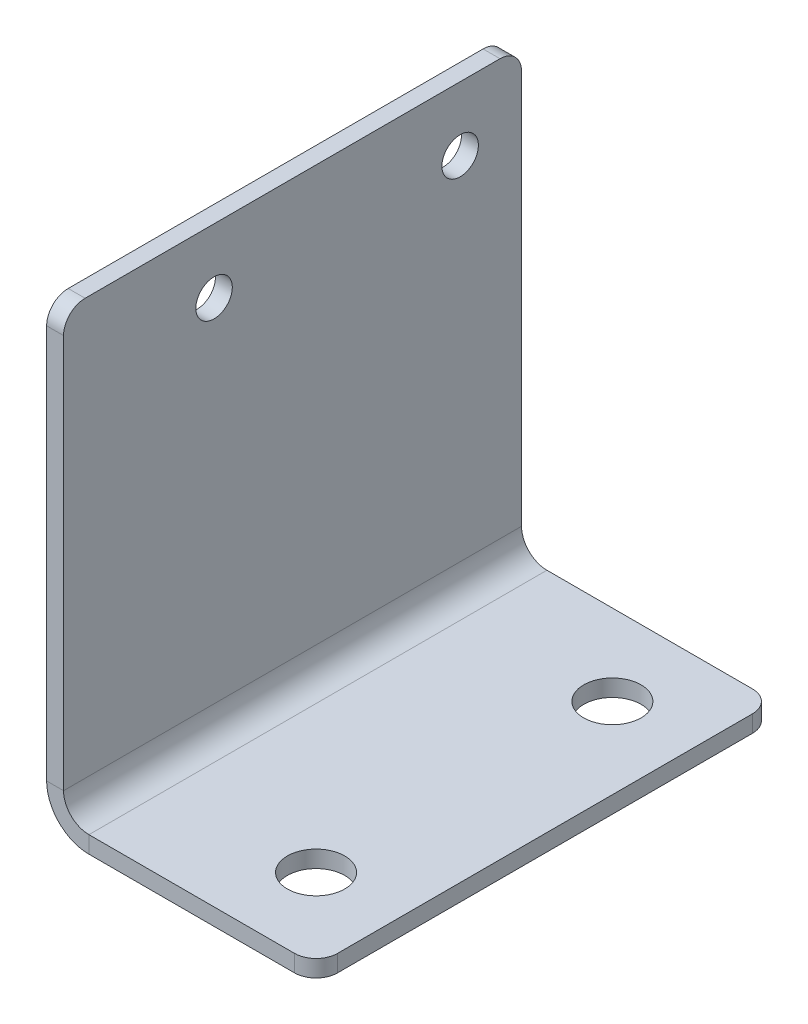
from build123d import *

# Parameters (mm, degrees)
BASE_FLANGE1_DEPTH      = 53.975
M4_CLEARANCE_HOLE1_D    = 4.3
F_1_4_CLEARANCE_HOLE1_D = 6.7564
FILLET1_R               = 2.54


# Read off the part's stored shape, not the designer's step: Base-Flange1
with BuildPart() as part:
    # Base-Flange1 outline → Base-Flange1 (new body)
    with BuildSketch(Plane.XY):
        with BuildLine():
            Line((4.98475, 0), (31.75, 0))
            Line((31.75, 0), (31.75, 1.9939))
            Line((31.75, 1.9939), (4.98475, 1.9939))
            ThreePointArc((4.98475, 1.9939), (2.869899683, 2.869899683), (1.9939, 4.98475))
            Line((1.9939, 4.98475), (1.9939, 53.975))
            Line((1.9939, 53.975), (0, 53.975))
            Line((0, 53.975), (0, 4.98475))
            ThreePointArc((0, 4.98475), (1.459999472, 1.459999472), (4.98475, 0))
        make_face()
    extrude(amount=BASE_FLANGE1_DEPTH)

    # M4 Clearance Hole1 (through all)
    with Locations(Plane.ZY):
        with Locations((36.2375, 46.419), (7.237499922, 46.419)):
            Hole(M4_CLEARANCE_HOLE1_D / 2)

    # 1/4 Clearance Hole1 (through all)
    with Locations(Plane(origin=(0, 1.9939, 0), x_dir=(1, 0, 0), z_dir=(0, 1, 0))):
        with Locations((22.225, -44.45), (22.225, -9.525)):
            Hole(F_1_4_CLEARANCE_HOLE1_D / 2)

    # Fillet1
    fillet1_edges = [part.edges().sort_by_distance(p)[0] for p in [
        (0.99695, 53.975, 53.975),
        (0.99695, 53.975, 0),
        (31.75, 0.99695, 53.975),
        (31.75, 0.99695, 0),
    ]]
    fillet(fillet1_edges, radius=FILLET1_R)


solid = part.part
